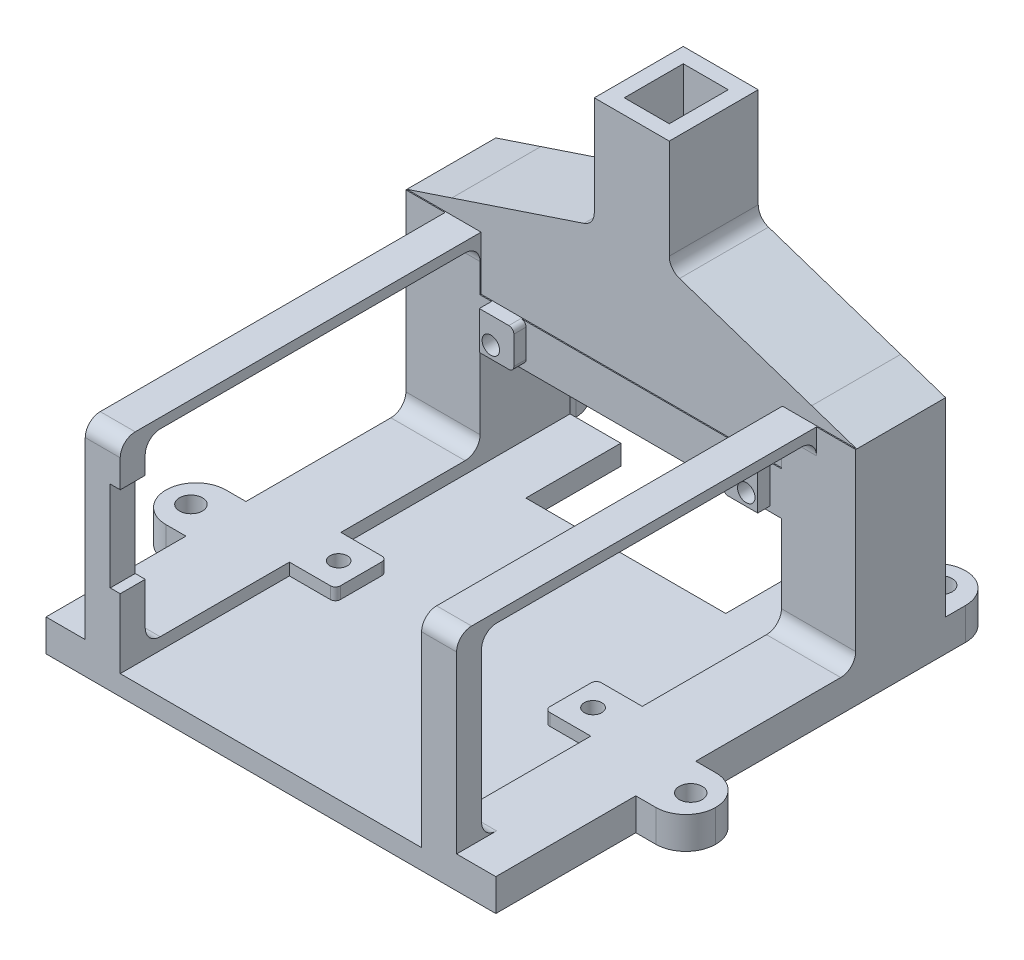
from build123d import *
from OCP.BRepFilletAPI import BRepFilletAPI_MakeChamfer

# Parameters (mm, degrees)
ESQUISSE2_W              = 90
ESQUISSE2_H              = 90
BOSS_EXTRU_1_DEPTH       = 4
ESQUISSE3_W              = 9.2
ESQUISSE3_H              = 10.3
BOSS_EXTRU_2_DEPTH       = 2.4
CONG_1_R                 = 1
ESQUISSE5_W              = 14.85
ESQUISSE5_H              = 90
BOSS_EXTRU_3_DEPTH       = 2.4
ESQUISSE6_W              = 7
ESQUISSE6_H              = 5
BOSS_EXTRU_4_DEPTH       = 38
ESQUISSE8_W              = 14.85
ESQUISSE8_H              = 18
BOSS_EXTRU_5_DEPTH       = 38
BOSS_EXTRU_6_REACH       = 97.814
ESQUISSE9_W              = 7
ESQUISSE9_H              = 2
SYM_TRIE1_START          = 4
SYM_TRIE1_OUTLINE_W      = 7
SYM_TRIE1_OUTLINE_H      = 5
SYM_TRIE1_OUTLINE_W_2    = 14.85
SYM_TRIE1_OUTLINE_H_2    = 18
SYM_TRIE1_DEPTH          = 40.4
SYM_TRIE1_2_DEPTH        = 2.4
SYM_TRIE1_START_2        = 42.4
SYM_TRIE1_3_OUTLINE_W    = 7
SYM_TRIE1_3_OUTLINE_H    = 67
SYM_TRIE1_3_DEPTH        = 2
ENL_V_MAT_EXTRU_1_REACH  = 111.983
ESQUISSE10_W             = 2
ESQUISSE10_H             = 18
ENL_V_MAT_EXTRU_2_REACH  = 77.38
ESQUISSE11_W             = 40
ESQUISSE11_H             = 18
ESQUISSE12_W             = 5
ESQUISSE12_H             = 8.6
BOSS_EXTRU_7_DEPTH       = 60.3
ESQUISSE13_W             = 6.9
ESQUISSE13_H             = 7.6
BOSS_EXTRU_8_DEPTH       = 2.45
CONG_2_R                 = 1
CONG_2_OF_SYM_TRIE2_R    = 1
BOSS_EXTRU_9_START       = -3
ESQUISSE14_W             = 90
ESQUISSE14_H             = 17.8
BOSS_EXTRU_9_DEPTH       = 6
ESQUISSE15_W             = 15
ESQUISSE15_H             = 17.8
BOSS_EXTRU_10_DEPTH      = 44
ESQUISSE16_W             = 90
ESQUISSE16_H             = 90
BOSS_EXTRU_11_DEPTH      = 11.6
ESQUISSE20_W             = 12
ESQUISSE20_H             = 6.4
BOSS_EXTRU_13_DEPTH      = 10
ESQUISSE21_W             = 12
ESQUISSE21_H             = 6.4
BOSS_EXTRU_14_DEPTH      = 10
CONG_3_R                 = 6
ENL_V_MAT_EXTRU_4_REACH  = 126.022
ESQUISSE23_R             = 2.3
CONG_3_OF_SYM_TRIE3_R    = 6
ENL_V_MAT_EXTRU_5_REACH  = 126.022
ESQUISSE24_R             = 1.75
ENL_V_MAT_EXTRU_6_REACH  = 137.909
ESQUISSE26_R             = 1.75
ESQUISSE27_W             = 50
ESQUISSE27_H             = 4
ENL_V_MAT_EXTRU_7_DEPTH  = 72.2
CHANFREIN3_SIZE          = 28.5
CHANFREIN3_SIZE2         = 9.5
CHANFREIN4_SIZE          = 10
CHANFREIN4_SIZE2         = 17.5
CHANFREIN8_START         = -45
CHANFREIN8_DEPTH         = 17.8
CHANFREIN9_SIZE          = 3
CHANFREIN9_SIZE_2        = 9
CHANFREIN10_START        = 25.930676813
CHANFREIN10_OUTLINE_W    = 40
CHANFREIN10_OUTLINE_H    = 3.16227766
CHANFREIN10_DEPTH        = 2.069323187
CONG_9_R                 = 3
ESQUISSE37_R             = 4
ENL_V_MAT_EXTRU_8_DEPTH  = 3
BOSS_EXTRU_15_DEPTH      = 4.8
CONG_11_R                = 3
CHANFREIN14_SIZE         = 10
CHANFREIN14_SIZE2        = 5
ESQUISSE40_W             = 90
ESQUISSE40_H             = 90
ENL_V_MAT_EXTRU_9_DEPTH  = 24
ESQUISSE41_W             = 9
ESQUISSE41_H             = 11.8
ENL_V_MAT_EXTRU_11_DEPTH = 15.4


with BuildPart() as part:
    # Esquisse2 → Boss.-Extru.1 (new body)
    with BuildSketch(Plane(origin=(0, 0, 0), x_dir=(1, 0, 0), z_dir=(0, 1, 0))):
        Rectangle(ESQUISSE2_W, ESQUISSE2_H)
    extrude(amount=BOSS_EXTRU_1_DEPTH)

    # Esquisse3 → Boss.-Extru.2 (add)
    with BuildSketch(Plane(origin=(0, 4, 0), x_dir=(1, 0, 0), z_dir=(0, 1, 0))):
        with Locations((25.55, -6)):
            Rectangle(ESQUISSE3_W, ESQUISSE3_H)
    extrude(amount=BOSS_EXTRU_2_DEPTH)

    # Congé1
    cong_1_edges = [part.edges().sort_by_distance(p)[0] for p in [
        (20.95, 5.2, 0.85),
        (20.95, 5.2, 11.15),
    ]]
    fillet(cong_1_edges, radius=CONG_1_R)

    # Esquisse5 → Boss.-Extru.3 (add)
    with BuildSketch(Plane(origin=(0, 4, 0), x_dir=(1, 0, 0), z_dir=(0, 1, 0))):
        with Locations((37.575, 0)):
            Rectangle(ESQUISSE5_W, ESQUISSE5_H)
    extrude(amount=BOSS_EXTRU_3_DEPTH)

    # Esquisse6 → Boss.-Extru.4 (add)
    with BuildSketch(Plane(origin=(0, 6.4, 0), x_dir=(1, 0, 0), z_dir=(0, 1, 0))):
        with Locations((33.65, -42.5)):
            Rectangle(ESQUISSE6_W, ESQUISSE6_H)
    extrude(amount=BOSS_EXTRU_4_DEPTH)

    # Esquisse8 → Boss.-Extru.5 (add)
    with BuildSketch(Plane(origin=(0, 6.4, 0), x_dir=(1, 0, 0), z_dir=(0, 1, 0))):
        with Locations((37.575, 36)):
            Rectangle(ESQUISSE8_W, ESQUISSE8_H)
    extrude(amount=BOSS_EXTRU_5_DEPTH)

    # Esquisse9 → Boss.-Extru.6 (add, up to next)
    with BuildSketch(Plane.XY.offset(-27), mode=Mode.PRIVATE) as boss_extru_6_sk1:
        with Locations((33.65, 43.4)):
            Rectangle(ESQUISSE9_W, ESQUISSE9_H)
    boss_extru_6_tool1 = extrude(boss_extru_6_sk1.sketch, amount=BOSS_EXTRU_6_REACH, mode=Mode.PRIVATE) - part.part
    add(boss_extru_6_tool1.solids().sort_by_distance((33.65, 43.4, -27))[0])

    # Symétrie1: read off the stored shape, not the designer's step
    # Symétrie1 outline → Symétrie1 (add)
    with BuildSketch(Plane(origin=(0, 0, 0), x_dir=(1, 0, 0), z_dir=(0, 1, 0)).offset(SYM_TRIE1_START)):
        with Locations((-33.65, -42.5)):
            Rectangle(SYM_TRIE1_OUTLINE_W, SYM_TRIE1_OUTLINE_H)
        with Locations((-37.575, 36)):
            Rectangle(SYM_TRIE1_OUTLINE_W_2, SYM_TRIE1_OUTLINE_H_2)
    extrude(amount=SYM_TRIE1_DEPTH)

    # Sym_trie1 2 outline → Sym_trie1 2 (add)
    with BuildSketch(Plane(origin=(0, 0, 0), x_dir=(1, 0, 0), z_dir=(0, 1, 0)).offset(SYM_TRIE1_START)):
        with BuildLine():
            Line((-37.15, -40), (-30.15, -40))
            Line((-30.15, -40), (-30.15, -11.15))
            Line((-30.15, -11.15), (-21.95, -11.15))
            ThreePointArc((-21.95, -11.15), (-21.242893219, -10.857106781), (-20.95, -10.15))
            Line((-20.95, -10.15), (-20.95, -1.85))
            ThreePointArc((-20.95, -1.85), (-21.242893219, -1.142893219), (-21.95, -0.85))
            Line((-21.95, -0.85), (-30.15, -0.85))
            Line((-30.15, -0.85), (-30.15, 27))
            Line((-30.15, 27), (-45, 27))
            Line((-45, 27), (-45, -45))
            Line((-45, -45), (-37.15, -45))
            Line((-37.15, -45), (-37.15, -40))
        make_face()
    extrude(amount=SYM_TRIE1_2_DEPTH)

    # Sym_trie1 3 outline → Sym_trie1 3 (add)
    with BuildSketch(Plane(origin=(0, 0, 0), x_dir=(1, 0, 0), z_dir=(0, 1, 0)).offset(SYM_TRIE1_START_2)):
        with Locations((-33.65, -6.5)):
            Rectangle(SYM_TRIE1_3_OUTLINE_W, SYM_TRIE1_3_OUTLINE_H)
    extrude(amount=SYM_TRIE1_3_DEPTH)

    # Esquisse10 → Enlèv. mat.-Extru.1 (cut, up to next)
    with BuildSketch(Plane.XY.offset(45), mode=Mode.PRIVATE) as enl_v_mat_extru_1_sk1:
        with Locations((-31.15, 26.85)):
            Rectangle(ESQUISSE10_W, ESQUISSE10_H)
    enl_v_mat_extru_1_tool1 = extrude(enl_v_mat_extru_1_sk1.sketch, amount=-ENL_V_MAT_EXTRU_1_REACH, mode=Mode.PRIVATE) & part.part
    add(enl_v_mat_extru_1_tool1.solids().sort_by_distance((-31.15, 26.85, 45))[0], mode=Mode.SUBTRACT)

    # Esquisse11 → Enlèv. mat.-Extru.2 (cut, up to next)
    with BuildSketch(Plane(origin=(0, 4, 0), x_dir=(1, 0, 0), z_dir=(0, 1, 0)), mode=Mode.PRIVATE) as enl_v_mat_extru_2_sk1:
        with Locations((0, 36)):
            Rectangle(ESQUISSE11_W, ESQUISSE11_H)
    enl_v_mat_extru_2_tool1 = extrude(enl_v_mat_extru_2_sk1.sketch, amount=-ENL_V_MAT_EXTRU_2_REACH, mode=Mode.PRIVATE) & part.part
    add(enl_v_mat_extru_2_tool1.solids().sort_by_distance((0, 4, -36))[0], mode=Mode.SUBTRACT)

    # Esquisse12 → Boss.-Extru.7 (add)
    with BuildSketch(Plane(origin=(-30.15, 0, 0), x_dir=(0, 0, -1), z_dir=(1, 0, 0))):
        with Locations((29.5, 29.34)):
            Rectangle(ESQUISSE12_W, ESQUISSE12_H)
    extrude(amount=BOSS_EXTRU_7_DEPTH)

    # Esquisse13 → Boss.-Extru.8 (add)
    with BuildSketch(Plane.XY.offset(-27)):
        with Locations((24.4, 29.84)):
            Rectangle(ESQUISSE13_W, ESQUISSE13_H)
    boss_extru_8 = extrude(amount=BOSS_EXTRU_8_DEPTH)

    # Congé2
    cong_2_edges = [part.edges().sort_by_distance(p)[0] for p in [
        (20.95, 33.64, -25.775),
        (20.95, 26.04, -25.775),
    ]]
    fillet(cong_2_edges, radius=CONG_2_R)

    # Symétrie2: Boss.-Extru.8 across plane
    add(boss_extru_8.mirror(Plane(origin=(0, 0, 0), x_dir=(0, 0, 1), z_dir=(1, 0, 0))))

    # Congé2 of Symétrie2
    cong_2_of_sym_trie2_edges = [part.edges().sort_by_distance(p)[0] for p in [
        (-20.95, 33.64, -25.775),
        (-20.95, 26.04, -25.775),
    ]]
    fillet(cong_2_of_sym_trie2_edges, radius=CONG_2_OF_SYM_TRIE2_R)

    # Esquisse14 → Boss.-Extru.9 (add)
    with BuildSketch(Plane(origin=(0, 44.4, 0), x_dir=(1, 0, 0), z_dir=(0, 1, 0)).offset(BOSS_EXTRU_9_START)):
        with Locations((0, 36.1)):
            Rectangle(ESQUISSE14_W, ESQUISSE14_H)
    extrude(amount=BOSS_EXTRU_9_DEPTH)

    # Esquisse15 → Boss.-Extru.10 (add)
    with BuildSketch(Plane(origin=(0, 47.4, 0), x_dir=(1, 0, 0), z_dir=(0, 1, 0))):
        with Locations((0, 36.1)):
            Rectangle(ESQUISSE15_W, ESQUISSE15_H)
    extrude(amount=BOSS_EXTRU_10_DEPTH)

    # Esquisse16 → Boss.-Extru.11 (add)
    with BuildSketch(Plane(origin=(0, 91.4, 0), x_dir=(1, 0, 0), z_dir=(0, 1, 0))):
        Rectangle(ESQUISSE16_W, ESQUISSE16_H)
    extrude(amount=BOSS_EXTRU_11_DEPTH)

    # Esquisse20 → Boss.-Extru.13 (add)
    with BuildSketch(Plane(origin=(45, 0, 0), x_dir=(0, 0, -1), z_dir=(1, 0, 0))):
        with Locations((-11, 3.2)):
            Rectangle(ESQUISSE20_W, ESQUISSE20_H)
    boss_extru_13 = extrude(amount=BOSS_EXTRU_13_DEPTH)

    # Esquisse21 → Boss.-Extru.14 (add)
    with BuildSketch(Plane(origin=(0, 0, -45), x_dir=(-1, 0, 0), z_dir=(0, 0, -1))):
        with Locations((-39, 3.2)):
            Rectangle(ESQUISSE21_W, ESQUISSE21_H)
    boss_extru_14 = extrude(amount=BOSS_EXTRU_14_DEPTH)

    # Congé3
    cong_3_edges = [part.edges().sort_by_distance(p)[0] for p in [
        (33, 3.2, -55),
        (45, 3.2, -55),
        (55, 3.2, 5),
        (55, 3.2, 17),
    ]]
    fillet(cong_3_edges, radius=CONG_3_R - 0.0001)  # a hair under: the kernel refuses the full size

    # Esquisse23 → Enlèv. mat.-Extru.4 (cut, up to next)
    with BuildSketch(Plane(origin=(0, 6.4, 0), x_dir=(1, 0, 0), z_dir=(0, 1, 0)), mode=Mode.PRIVATE) as enl_v_mat_extru_4_sk1:
        with Locations(Location((50, -11, 0), (0, 0, 270))):
            Circle(ESQUISSE23_R)
    enl_v_mat_extru_4_tool1 = extrude(enl_v_mat_extru_4_sk1.sketch, amount=-ENL_V_MAT_EXTRU_4_REACH, mode=Mode.PRIVATE) & part.part
    # Esquisse23 → Enlèv. mat.-Extru.4 (cut, up to next)
    with BuildSketch(Plane(origin=(0, 6.4, 0), x_dir=(1, 0, 0), z_dir=(0, 1, 0)), mode=Mode.PRIVATE) as enl_v_mat_extru_4_sk2:
        with Locations(Location((39, 50, 0), (0, 0, 270))):
            Circle(ESQUISSE23_R)
    enl_v_mat_extru_4_tool2 = extrude(enl_v_mat_extru_4_sk2.sketch, amount=-ENL_V_MAT_EXTRU_4_REACH, mode=Mode.PRIVATE) & part.part
    enl_v_mat_extru_4_1 = enl_v_mat_extru_4_tool1.solids().sort_by_distance((50, 6.4, 11))[0]
    add(enl_v_mat_extru_4_1, mode=Mode.SUBTRACT)
    enl_v_mat_extru_4_2 = enl_v_mat_extru_4_tool2.solids().sort_by_distance((39, 6.4, -50))[0]
    add(enl_v_mat_extru_4_2, mode=Mode.SUBTRACT)
    enl_v_mat_extru_4 = enl_v_mat_extru_4_1 + enl_v_mat_extru_4_2  # Enlèv. mat.-Extru.4 as one shape, for the pattern or mirror that repeats it

    # Symétrie3: Boss.-Extru.13, Boss.-Extru.14, Enlèv. mat.-Extru.4 across plane
    add(boss_extru_13.mirror(Plane(origin=(0, 0, 0), x_dir=(0, 0, 1), z_dir=(1, 0, 0))))
    add(boss_extru_14.mirror(Plane(origin=(0, 0, 0), x_dir=(0, 0, 1), z_dir=(1, 0, 0))))
    add(enl_v_mat_extru_4.mirror(Plane(origin=(0, 0, 0), x_dir=(0, 0, 1), z_dir=(1, 0, 0))), mode=Mode.SUBTRACT)

    # Congé3 of Symétrie3
    cong_3_of_sym_trie3_edges = [part.edges().sort_by_distance(p)[0] for p in [
        (-33, 3.2, -55),
        (-45, 3.2, -55),
        (-55, 3.2, 5),
        (-55, 3.2, 17),
    ]]
    fillet(cong_3_of_sym_trie3_edges, radius=CONG_3_OF_SYM_TRIE3_R - 0.0001)  # a hair under: the kernel refuses the full size

    # Esquisse24 → Enlèv. mat.-Extru.5 (cut, up to next)
    with BuildSketch(Plane(origin=(0, 6.4, 0), x_dir=(1, 0, 0), z_dir=(0, 1, 0)), mode=Mode.PRIVATE) as enl_v_mat_extru_5_sk1:
        with Locations(Location((25.45, -6, 0), (0, 0, 270))):
            Circle(ESQUISSE24_R)
    enl_v_mat_extru_5_tool1 = extrude(enl_v_mat_extru_5_sk1.sketch, amount=-ENL_V_MAT_EXTRU_5_REACH, mode=Mode.PRIVATE) & part.part
    enl_v_mat_extru_5 = enl_v_mat_extru_5_tool1.solids().sort_by_distance((25.45, 6.4, 6))[0]
    add(enl_v_mat_extru_5, mode=Mode.SUBTRACT)

    # Esquisse26 → Enlèv. mat.-Extru.6 (cut, up to next)
    with BuildSketch(Plane.XY.offset(-24.55), mode=Mode.PRIVATE) as enl_v_mat_extru_6_sk1:
        with Locations((25.55, 28.44)):
            Circle(ESQUISSE26_R)
    enl_v_mat_extru_6_tool1 = extrude(enl_v_mat_extru_6_sk1.sketch, amount=-ENL_V_MAT_EXTRU_6_REACH, mode=Mode.PRIVATE) & part.part
    enl_v_mat_extru_6 = enl_v_mat_extru_6_tool1.solids().sort_by_distance((25.55, 28.44, -24.55))[0]
    add(enl_v_mat_extru_6, mode=Mode.SUBTRACT)

    # Symétrie5: Enlèv. mat.-Extru.5, Enlèv. mat.-Extru.6 across plane
    add(enl_v_mat_extru_5.mirror(Plane(origin=(0, 0, 0), x_dir=(0, 0, 1), z_dir=(1, 0, 0))), mode=Mode.SUBTRACT)
    add(enl_v_mat_extru_6.mirror(Plane(origin=(0, 0, 0), x_dir=(0, 0, 1), z_dir=(1, 0, 0))), mode=Mode.SUBTRACT)

    # Esquisse27 → Enlèv. mat.-Extru.7 (cut)
    with BuildSketch(Plane.XY.offset(45)):
        with Locations((0, 93.4)):
            Rectangle(ESQUISSE27_W, ESQUISSE27_H)
    extrude(amount=-ENL_V_MAT_EXTRU_7_DEPTH, mode=Mode.SUBTRACT)

    # Chanfrein3: one chamfer whose edges measure the first distance from different faces: ONE call of the kernel's chamfer builder (chamfer() names one face for all edges)
    chanfrein3_edges_1 = [part.edges().sort_by_distance(p)[0] for p in [
        (-7.5, 47.4, -36.1),
    ]]
    chanfrein3_side_1 = [part.faces().sort_by_distance(p)[0] for p in [
        (-26.25, 47.4, -36.1),
    ]]
    chanfrein3_edges_2 = [part.edges().sort_by_distance(p)[0] for p in [
        (7.5, 47.4, -36.1),
    ]]
    chanfrein3_side_2 = [part.faces().sort_by_distance(p)[0] for p in [
        (26.25, 47.4, -36.1),
    ]]
    chanfrein3 = BRepFilletAPI_MakeChamfer(part.part.solid().wrapped)
    for e in chanfrein3_edges_1:
        chanfrein3.Add(CHANFREIN3_SIZE, CHANFREIN3_SIZE2, e.wrapped, chanfrein3_side_1[0].wrapped)  # the first distance lies on this face
    for e in chanfrein3_edges_2:
        chanfrein3.Add(CHANFREIN3_SIZE, CHANFREIN3_SIZE2, e.wrapped, chanfrein3_side_2[0].wrapped)  # the first distance lies on this face
    add(Compound.cast(chanfrein3.Shape()), mode=Mode.REPLACE)

    # Chanfrein4: one chamfer whose edges measure the first distance from different faces: ONE call of the kernel's chamfer builder (chamfer() names one face for all edges)
    chanfrein4_edges_1 = [part.edges().sort_by_distance(p)[0] for p in [
        (7.5, 91.4, -36.1),
    ]]
    chanfrein4_side_1 = [part.faces().sort_by_distance(p)[0] for p in [
        (7.5, 74.15, -36.1),
    ]]
    chanfrein4_edges_2 = [part.edges().sort_by_distance(p)[0] for p in [
        (-7.5, 91.4, -36.1),
    ]]
    chanfrein4_side_2 = [part.faces().sort_by_distance(p)[0] for p in [
        (-7.5, 74.15, -36.1),
    ]]
    chanfrein4 = BRepFilletAPI_MakeChamfer(part.part.solid().wrapped)
    for e in chanfrein4_edges_1:
        chanfrein4.Add(CHANFREIN4_SIZE, CHANFREIN4_SIZE2, e.wrapped, chanfrein4_side_1[0].wrapped)  # the first distance lies on this face
    for e in chanfrein4_edges_2:
        chanfrein4.Add(CHANFREIN4_SIZE, CHANFREIN4_SIZE2, e.wrapped, chanfrein4_side_2[0].wrapped)  # the first distance lies on this face
    add(Compound.cast(chanfrein4.Shape()), mode=Mode.REPLACE)

    # Chanfrein8: read off the stored shape, not the designer's step
    # Chanfrein8 outline → Chanfrein8 (add)
    with BuildSketch(Plane.XY.offset(CHANFREIN8_START)):
        Polygon((30.15, 31.35), (30.15, 41.4), (0, 41.4), align=None)
    extrude(amount=CHANFREIN8_DEPTH)

    # Chanfrein9
    chanfrein9_edges_1 = [part.edges().sort_by_distance(p)[0] for p in [
        (45, 47.4, -36.1),
    ]]
    chanfrein9_side_1 = [part.faces().sort_by_distance(p)[0] for p in [
        (45, 47.34, -36.1),
    ]]
    chanfrein9_edges_2 = [part.edges().sort_by_distance(p)[0] for p in [
        (-45, 47.4, -36.1),
    ]]
    chanfrein9_side_2 = [part.faces().sort_by_distance(p)[0] for p in [
        (-44.94, 47.4, -36.1),
    ]]
    chanfrein9 = BRepFilletAPI_MakeChamfer(part.part.solid().wrapped)
    for e in chanfrein9_edges_1:
        chanfrein9.Add(CHANFREIN9_SIZE - 0.0001, CHANFREIN9_SIZE_2 - 0.0001, e.wrapped, chanfrein9_side_1[0].wrapped)
    for e in chanfrein9_edges_2:
        chanfrein9.Add(CHANFREIN9_SIZE_2 - 0.0001, CHANFREIN9_SIZE - 0.0001, e.wrapped, chanfrein9_side_2[0].wrapped)
    add(Compound.cast(chanfrein9.Shape()), mode=Mode.REPLACE)  # a hair under: the kernel refuses the full size

    # Chanfrein10: read off the stored shape, not the designer's step
    # Chanfrein10 outline → Chanfrein10 (cut)
    with BuildSketch(Plane(origin=(0, 0, 0), x_dir=(1, 0, 0), z_dir=(0, 0.31622776601683705, -0.9486832980505141)).offset(CHANFREIN10_START)):
        with Locations((0, 6.008327554)):
            Rectangle(CHANFREIN10_OUTLINE_W, CHANFREIN10_OUTLINE_H)
    extrude(amount=CHANFREIN10_DEPTH, mode=Mode.SUBTRACT)

    # Congé9
    cong_9_edges = [part.edges().sort_by_distance(p)[0] for p in [
        (-33.65, 44.4, 45),
        (-33.65, 6.4, 40),
        (-37.575, 6.4, -27),
        (-33.65, 42.4, 40),
        (-33.65, 42.4, -27),
        (33.65, 6.4, 40),
        (33.65, 44.4, 45),
        (37.575, 6.4, -27),
        (33.65, 42.4, 40),
        (33.65, 42.4, -27),
    ]]
    fillet(cong_9_edges, radius=CONG_9_R)

    # Chanfrein13
    # the kernel refuses this chamfer: 31.5, 10.5 mm, written as the material it adds along each edge
    with BuildSketch(Plane(origin=(-30.15, 41.4, -27.2), x_dir=(0, -1, 0), z_dir=(0, 0, -1))) as chanfrein13_piece_1:
        with BuildLine():
            Line((10.898446985, 1.195340956), (-0.398446985, -32.695340956))
            Line((-0.398446985, -32.695340956), (-1.028446985, -32.695340956))
            ThreePointArc((-1.028446985, -32.695340956), (-0.63, -16.347670478), (-0.63, 0))
            Line((-0.63, 0), (0, 0.63))
            ThreePointArc((0, 0.63), (5.449223493, 0.63), (10.898446985, 1.825340956))
            Line((10.898446985, 1.825340956), (10.898446985, 1.195340956))
        make_face()
    extrude(amount=17.8)

    # Esquisse37 → Enlèv. mat.-Extru.8 (cut)
    with BuildSketch(Plane.XZ):
        with Locations(Location((-25.45, 6, 0), (0, 0, 270))):
            Circle(ESQUISSE37_R)
        with Locations(Location((25.45, 6, 0), (0, 0, 270))):
            Circle(ESQUISSE37_R)
    extrude(amount=-ENL_V_MAT_EXTRU_8_DEPTH, mode=Mode.SUBTRACT)

    # Esquisse38 → Boss.-Extru.15 (add)
    with BuildSketch(Plane.XY.offset(-27.2)):
        Polygon((0.675, 41.175), (-21.95, 33.64), (23.28, 33.64), align=None)
    extrude(amount=-BOSS_EXTRU_15_DEPTH)

    # Congé11
    cong_11_edges = [part.edges().sort_by_distance(p)[0] for p in [
        (7.5, 56.9, -36.1),
        (-7.5, 56.9, -36.1),
        (-25, 91.4, -36.1),
        (-7.5, 81.4, -36.1),
        (25, 91.4, -36.1),
        (7.5, 81.4, -36.1),
        (30.15, 31.35, -38.5),
        (-30.15, 30.9, -38.5),
        (0.675, 41.175, -38.5),
    ]]
    fillet(cong_11_edges, radius=CONG_11_R)

    # Chanfrein14
    chanfrein14_edges = [part.edges().sort_by_distance(p)[0] for p in [
        (0, 95.4, -27.2),
    ]]
    chanfrein14_side = [part.faces().sort_by_distance(p)[0] for p in [
        (0, 95.4, 8.9),
    ]]
    chamfer(chanfrein14_edges, length=CHANFREIN14_SIZE, length2=CHANFREIN14_SIZE2, reference=chanfrein14_side[0])

    # Esquisse40 → Enlèv. mat.-Extru.9 (cut)
    with BuildSketch(Plane(origin=(0, 103, 0), x_dir=(1, 0, 0), z_dir=(0, 1, 0))):
        Rectangle(ESQUISSE40_W, ESQUISSE40_H)
    extrude(amount=-ENL_V_MAT_EXTRU_9_DEPTH, mode=Mode.SUBTRACT)

    # Esquisse41 → Enlèv. mat.-Extru.11 (cut)
    with BuildSketch(Plane(origin=(0, 79, 0), x_dir=(1, 0, 0), z_dir=(0, 1, 0))):
        with Locations((0, 36.1)):
            Rectangle(ESQUISSE41_W, ESQUISSE41_H)
    extrude(amount=-ENL_V_MAT_EXTRU_11_DEPTH, mode=Mode.SUBTRACT)


solid = part.part
